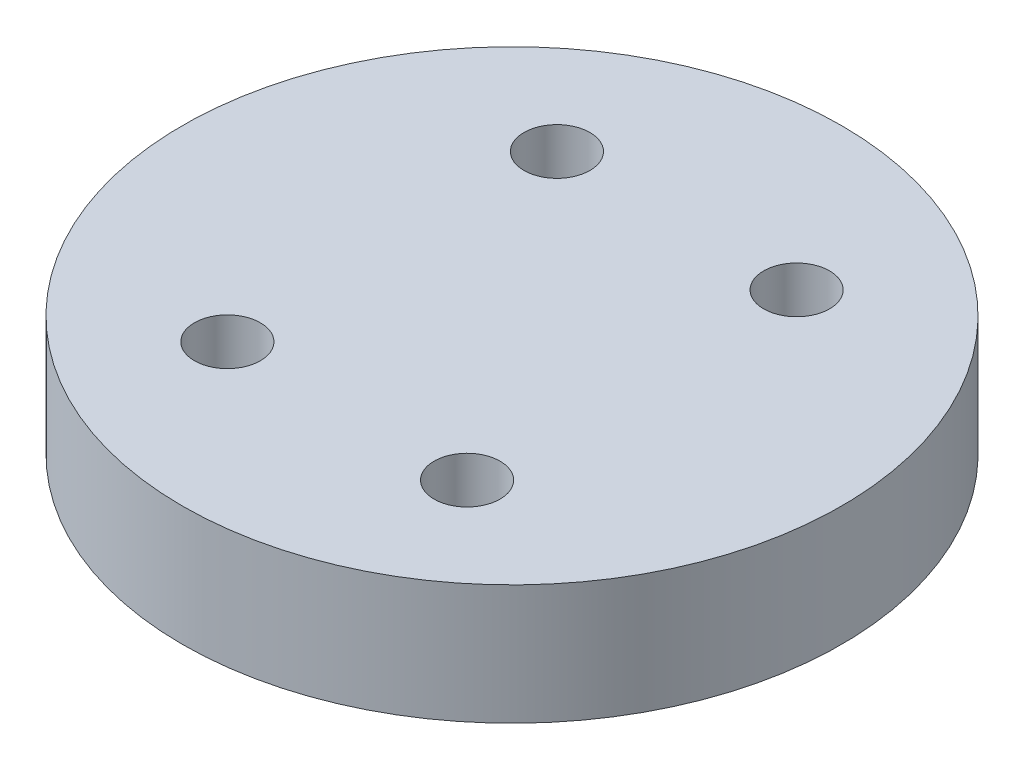
from build123d import *

# Parameters (mm, degrees)
SKETCH1_R           = 27.5
SKETCH1_R_2         = 2.75
BOSS_EXTRUDE1_DEPTH = 10


with BuildPart() as part:
    # Sketch1 → Boss-Extrude1 (new body)
    with BuildSketch(Plane(origin=(0, 0, 0), x_dir=(1, 0, 0), z_dir=(0, 1, 0))):
        Circle(SKETCH1_R)
        with Locations((10, -13.75)):
            Circle(SKETCH1_R_2, mode=Mode.SUBTRACT)
        with Locations((-10, -13.75)):
            Circle(SKETCH1_R_2, mode=Mode.SUBTRACT)
        with Locations((-10, 13.75)):
            Circle(SKETCH1_R_2, mode=Mode.SUBTRACT)
        with Locations((10, 13.75)):
            Circle(SKETCH1_R_2, mode=Mode.SUBTRACT)
    extrude(amount=BOSS_EXTRUDE1_DEPTH)


solid = part.part
